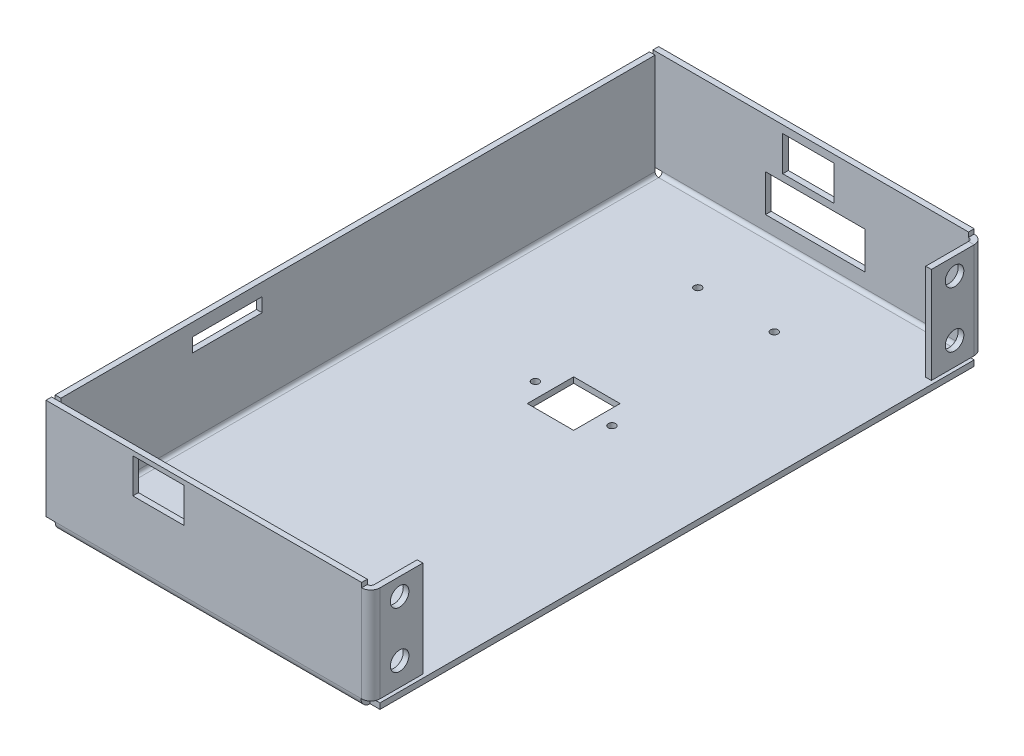
from build123d import *

# Parameters (mm, degrees)
SKETCH2_W                    = 70
SKETCH2_H                    = 132.04
BASE_FLANGE1_DEPTH           = 1.2192
EDGE_FLANGE1_STRIP_W         = 6.3968
EDGE_FLANGE1_STRIP_H         = 1.2192
EDGE_FLANGE1_STRIP_CUT_DEPTH = 70
EDGE_FLANGE1_DEPTH           = 70
EDGE_FLANGE2_STRIP_W         = 6.3968
EDGE_FLANGE2_STRIP_H         = 1.2192
EDGE_FLANGE2_STRIP_CUT_DEPTH = 70
EDGE_FLANGE2_DEPTH           = 70
EDGE_FLANGE3_STRIP_W         = 6.3968
EDGE_FLANGE3_STRIP_H         = 1.2192
EDGE_FLANGE3_STRIP_CUT_DEPTH = 21.73
EDGE_FLANGE3_DEPTH           = 21.73
EDGE_FLANGE4_STRIP_W         = 6.3968
EDGE_FLANGE4_STRIP_H         = 1.2192
EDGE_FLANGE4_STRIP_CUT_DEPTH = 21.73
EDGE_FLANGE4_DEPTH           = 21.73
EDGE_FLANGE5_STRIP_W         = 6.3968
EDGE_FLANGE5_STRIP_H         = 1.2192
EDGE_FLANGE5_STRIP_CUT_DEPTH = 128.0816
EDGE_FLANGE5_DEPTH           = 128.0816
SKETCH24_W                   = 2.12
SKETCH24_H                   = 1.9792
CUT_EXTRUDE1_DEPTH           = 1.98
SKETCH29_W                   = 1.9792
SKETCH29_H                   = 2.12
CUT_EXTRUDE2_DEPTH           = 1.98
SKETCH30_W                   = 1.9792
SKETCH30_H                   = 1.9792
CUT_EXTRUDE3_DEPTH           = 1.98
SKETCH31_W                   = 1.9792
SKETCH31_H                   = 1.9792
CUT_EXTRUDE4_DEPTH           = 1.98
SKETCH34_W                   = 1.9792
SKETCH34_H                   = 1
CUT_EXTRUDE5_DEPTH           = 151.154943887
F_4_0MM_DOWEL_HOLE1_D        = 4
F_4_0MM_DOWEL_HOLE1_DEPTH    = 1.2192
CUT_EXTRUDE6_REACH           = 152.155
SKETCH38_W                   = 11
SKETCH38_H                   = 7.5
CUT_EXTRUDE7_REACH           = 152.155
SKETCH39_W                   = 11
SKETCH39_H                   = 7.5
CUT_EXTRUDE8_REACH           = 117.673
SKETCH40_W                   = 15
SKETCH40_H                   = 3
M2_TAPPED_HOLE1_D            = 1.6
CUT_EXTRUDE9_REACH           = 116.396
SKETCH41_W                   = 10
SKETCH41_H                   = 10
CUT_EXTRUDE10_REACH          = 152.155
SKETCH45_W                   = 21.5
SKETCH45_H                   = 8


# Sheet-metal steps are written as plain solids
with BuildPart() as part:
    # Sketch2 → Base-Flange1 (new body)
    with BuildSketch(Plane(origin=(0, 0, 0), x_dir=(1, 0, 0), z_dir=(0, 1, 0))):
        with Locations((32.868589744, -23.279615385)):
            Rectangle(SKETCH2_W, SKETCH2_H)
    extrude(amount=-BASE_FLANGE1_DEPTH)

    # Edge-Flange1 strip (across the edge) → Edge-Flange1 strip cut (cut)
    with BuildSketch(Plane(origin=(67.868589744, 0, -42.740384615), x_dir=(0, 0, 1), z_dir=(-1, 0, 0))):
        with Locations((-1.2192, -0.6096)):
            Rectangle(EDGE_FLANGE1_STRIP_W, EDGE_FLANGE1_STRIP_H)
    extrude(amount=EDGE_FLANGE1_STRIP_CUT_DEPTH, mode=Mode.SUBTRACT)

    # Edge-Flange1 section (across the edge) → Edge-Flange1 (add)
    with BuildSketch(Plane(origin=(67.868589744, 0, -42.740384615), x_dir=(0, 0, 1), z_dir=(-1, 0, 0))):
        with BuildLine():
            Line((0, 0.76), (0, 22.49))
            Line((0, 22.49), (1.2192, 22.49))
            Line((1.2192, 22.49), (1.2192, 0.76))
            ThreePointArc((1.2192, 0.76), (1.441798846, 0.222598846), (1.9792, 0))
            Line((1.9792, 0), (1.9792, -1.2192))
            ThreePointArc((1.9792, -1.2192), (0.579694259, -0.639505741), (0, 0.76))
        make_face()
    extrude(amount=EDGE_FLANGE1_DEPTH)

    # Edge-Flange2 strip (across the edge) → Edge-Flange2 strip cut (cut)
    with BuildSketch(Plane(origin=(-2.131410256, 0, 89.299615385), x_dir=(0, 0, -1), z_dir=(1, 0, 0))):
        with Locations((-1.2192, -0.6096)):
            Rectangle(EDGE_FLANGE2_STRIP_W, EDGE_FLANGE2_STRIP_H)
    extrude(amount=EDGE_FLANGE2_STRIP_CUT_DEPTH, mode=Mode.SUBTRACT)

    # Edge-Flange2 section (across the edge) → Edge-Flange2 (add)
    with BuildSketch(Plane(origin=(-2.131410256, 0, 89.299615385), x_dir=(0, 0, -1), z_dir=(1, 0, 0))):
        with BuildLine():
            Line((0, 0.76), (0, 22.49))
            Line((0, 22.49), (1.2192, 22.49))
            Line((1.2192, 22.49), (1.2192, 0.76))
            ThreePointArc((1.2192, 0.76), (1.441798846, 0.222598846), (1.9792, 0))
            Line((1.9792, 0), (1.9792, -1.2192))
            ThreePointArc((1.9792, -1.2192), (0.579694259, -0.639505741), (0, 0.76))
        make_face()
    extrude(amount=EDGE_FLANGE2_DEPTH)

    # Edge-Flange3 strip (across the edge) → Edge-Flange3 strip cut (cut)
    with BuildSketch(Plane(origin=(67.868589744, 0.76, -41.521184615), x_dir=(-1, 0, 0), z_dir=(0, 1, 0))):
        with Locations((-1.2192, -0.6096)):
            Rectangle(EDGE_FLANGE3_STRIP_W, EDGE_FLANGE3_STRIP_H)
    extrude(amount=EDGE_FLANGE3_STRIP_CUT_DEPTH, mode=Mode.SUBTRACT)

    # Edge-Flange3 section (across the edge) → Edge-Flange3 (add)
    with BuildSketch(Plane(origin=(67.868589744, 0.76, -41.521184615), x_dir=(-1, 0, 0), z_dir=(0, 1, 0))):
        with BuildLine():
            Line((0, 0.76), (0, 10))
            Line((0, 10), (1.2192, 10))
            Line((1.2192, 10), (1.2192, 0.76))
            ThreePointArc((1.2192, 0.76), (1.441798846, 0.222598846), (1.9792, 0))
            Line((1.9792, 0), (1.9792, -1.2192))
            ThreePointArc((1.9792, -1.2192), (0.579694259, -0.639505741), (0, 0.76))
        make_face()
    extrude(amount=EDGE_FLANGE3_DEPTH)

    # Edge-Flange4 strip (across the edge) → Edge-Flange4 strip cut (cut)
    with BuildSketch(Plane(origin=(67.868589744, 22.49, 88.080415385), x_dir=(-1, 0, 0), z_dir=(0, -1, 0))):
        with Locations((-1.2192, -0.6096)):
            Rectangle(EDGE_FLANGE4_STRIP_W, EDGE_FLANGE4_STRIP_H)
    extrude(amount=EDGE_FLANGE4_STRIP_CUT_DEPTH, mode=Mode.SUBTRACT)

    # Edge-Flange4 section (across the edge) → Edge-Flange4 (add)
    with BuildSketch(Plane(origin=(67.868589744, 22.49, 88.080415385), x_dir=(-1, 0, 0), z_dir=(0, -1, 0))):
        with BuildLine():
            Line((0, 0.76), (0, 10))
            Line((0, 10), (1.2192, 10))
            Line((1.2192, 10), (1.2192, 0.76))
            ThreePointArc((1.2192, 0.76), (1.441798846, 0.222598846), (1.9792, 0))
            Line((1.9792, 0), (1.9792, -1.2192))
            ThreePointArc((1.9792, -1.2192), (0.579694259, -0.639505741), (0, 0.76))
        make_face()
    extrude(amount=EDGE_FLANGE4_DEPTH)

    # Edge-Flange5 strip (across the edge) → Edge-Flange5 strip cut (cut)
    with BuildSketch(Plane(origin=(-2.131410256, 0, -40.761184615), x_dir=(1, 0, 0), z_dir=(0, 0, 1))):
        with Locations((-1.2192, -0.6096)):
            Rectangle(EDGE_FLANGE5_STRIP_W, EDGE_FLANGE5_STRIP_H)
    extrude(amount=EDGE_FLANGE5_STRIP_CUT_DEPTH, mode=Mode.SUBTRACT)

    # Edge-Flange5 section (across the edge) → Edge-Flange5 (add)
    with BuildSketch(Plane(origin=(-2.131410256, 0, -40.761184615), x_dir=(1, 0, 0), z_dir=(0, 0, 1))):
        with BuildLine():
            Line((0, 0.76), (0, 22.49))
            Line((0, 22.49), (1.2192, 22.49))
            Line((1.2192, 22.49), (1.2192, 0.76))
            ThreePointArc((1.2192, 0.76), (1.441798846, 0.222598846), (1.9792, 0))
            Line((1.9792, 0), (1.9792, -1.2192))
            ThreePointArc((1.9792, -1.2192), (0.579694259, -0.639505741), (0, 0.76))
        make_face()
    extrude(amount=EDGE_FLANGE5_DEPTH)

    # Sketch24 → Cut-Extrude1 (cut)
    with BuildSketch(Plane.XZ.offset(1.2192)):
        with Locations((66.808589744, 88.310015385)):
            Rectangle(SKETCH24_W, SKETCH24_H)
    extrude(amount=-CUT_EXTRUDE1_DEPTH, mode=Mode.SUBTRACT)

    # Sketch29 → Cut-Extrude2 (cut)
    with BuildSketch(Plane.XZ.offset(1.2192)):
        with Locations((-1.141810256, 88.380415385)):
            Rectangle(SKETCH29_W, SKETCH29_H)
    extrude(amount=-CUT_EXTRUDE2_DEPTH, mode=Mode.SUBTRACT)

    # Sketch30 → Cut-Extrude3 (cut)
    with BuildSketch(Plane.XZ.offset(1.2192)):
        with Locations((-1.141810256, -41.750784615)):
            Rectangle(SKETCH30_W, SKETCH30_H)
    extrude(amount=-CUT_EXTRUDE3_DEPTH, mode=Mode.SUBTRACT)

    # Sketch31 → Cut-Extrude4 (cut)
    with BuildSketch(Plane.XZ.offset(1.2192)):
        with Locations((66.878989744, -41.750784615)):
            Rectangle(SKETCH31_W, SKETCH31_H)
    extrude(amount=-CUT_EXTRUDE4_DEPTH, mode=Mode.SUBTRACT)

    # Sketch34 → Cut-Extrude5 (cut, through all)
    with BuildSketch(Plane.XY.offset(89.299615385)):
        with Locations((66.878989744, 21.99)):
            Rectangle(SKETCH34_W, SKETCH34_H)
    extrude(amount=-CUT_EXTRUDE5_DEPTH, mode=Mode.SUBTRACT)

    # Ø4.0mm Dowel Hole1
    with Locations(Plane(origin=(67.868589744, 0, 0), x_dir=(0, 0, -1), z_dir=(1, 0, 0))):
        with Locations((-83.080415385, 17.76), (-83.080415385, 5.76), (36.521184615, 17.76), (36.521184615, 5.76)):
            Hole(F_4_0MM_DOWEL_HOLE1_D / 2, depth=F_4_0MM_DOWEL_HOLE1_DEPTH)

    # Sketch38 → Cut-Extrude6 (cut, up to next)
    with BuildSketch(Plane.XY.offset(89.299615385), mode=Mode.PRIVATE) as cut_extrude6_sk1:
        with Locations((22.088589744, 17.74)):
            Rectangle(SKETCH38_W, SKETCH38_H)
    cut_extrude6_tool1 = extrude(cut_extrude6_sk1.sketch, amount=-CUT_EXTRUDE6_REACH, mode=Mode.PRIVATE) & part.part
    add(cut_extrude6_tool1.solids().sort_by_distance((22.08859, 17.74, 89.299615))[0], mode=Mode.SUBTRACT)

    # Sketch39 → Cut-Extrude7 (cut, up to next)
    with BuildSketch(Plane(origin=(0, 0, -42.740384615), x_dir=(-1, 0, 0), z_dir=(0, 0, -1)), mode=Mode.PRIVATE) as cut_extrude7_sk1:
        with Locations((-31.338589744, 17.09)):
            Rectangle(SKETCH39_W, SKETCH39_H)
    cut_extrude7_tool1 = extrude(cut_extrude7_sk1.sketch, amount=-CUT_EXTRUDE7_REACH, mode=Mode.PRIVATE) & part.part
    add(cut_extrude7_tool1.solids().sort_by_distance((31.33859, 17.09, -42.740385))[0], mode=Mode.SUBTRACT)

    # Sketch40 → Cut-Extrude8 (cut, up to next)
    with BuildSketch(Plane.ZY.offset(2.131410256), mode=Mode.PRIVATE) as cut_extrude8_sk1:
        with Locations((51.420415385, 18.24)):
            Rectangle(SKETCH40_W, SKETCH40_H)
    cut_extrude8_tool1 = extrude(cut_extrude8_sk1.sketch, amount=-CUT_EXTRUDE8_REACH, mode=Mode.PRIVATE) & part.part
    add(cut_extrude8_tool1.solids().sort_by_distance((-2.13141, 18.24, 51.420415))[0], mode=Mode.SUBTRACT)

    # M2 Tapped Hole1 (through all)
    with Locations(Plane(origin=(0, 0, 0), x_dir=(1, 0, 0), z_dir=(0, 1, 0))):
        with Locations((24.618589744, 24.431184615), (41.118589744, 24.431184615), (41.118589744, -10.568815385), (24.618589744, -10.568815385)):
            Hole(M2_TAPPED_HOLE1_D / 2)

    # Sketch41 → Cut-Extrude9 (cut, up to next)
    with BuildSketch(Plane(origin=(0, 0, 0), x_dir=(1, 0, 0), z_dir=(0, 1, 0)), mode=Mode.PRIVATE) as cut_extrude9_sk1:
        with Locations((32.868589744, -10.568815385)):
            Rectangle(SKETCH41_W, SKETCH41_H)
    cut_extrude9_tool1 = extrude(cut_extrude9_sk1.sketch, amount=-CUT_EXTRUDE9_REACH, mode=Mode.PRIVATE) & part.part
    add(cut_extrude9_tool1.solids().sort_by_distance((32.86859, 0, 10.568815))[0], mode=Mode.SUBTRACT)

    # Sketch45 → Cut-Extrude10 (cut, up to next)
    with BuildSketch(Plane(origin=(0, 0, -42.740384615), x_dir=(-1, 0, 0), z_dir=(0, 0, -1)), mode=Mode.PRIVATE) as cut_extrude10_sk1:
        with Locations((-32.868589744, 7.8608)):
            Rectangle(SKETCH45_W, SKETCH45_H)
    cut_extrude10_tool1 = extrude(cut_extrude10_sk1.sketch, amount=-CUT_EXTRUDE10_REACH, mode=Mode.PRIVATE) & part.part
    add(cut_extrude10_tool1.solids().sort_by_distance((32.86859, 7.8608, -42.740385))[0], mode=Mode.SUBTRACT)


solid = part.part
